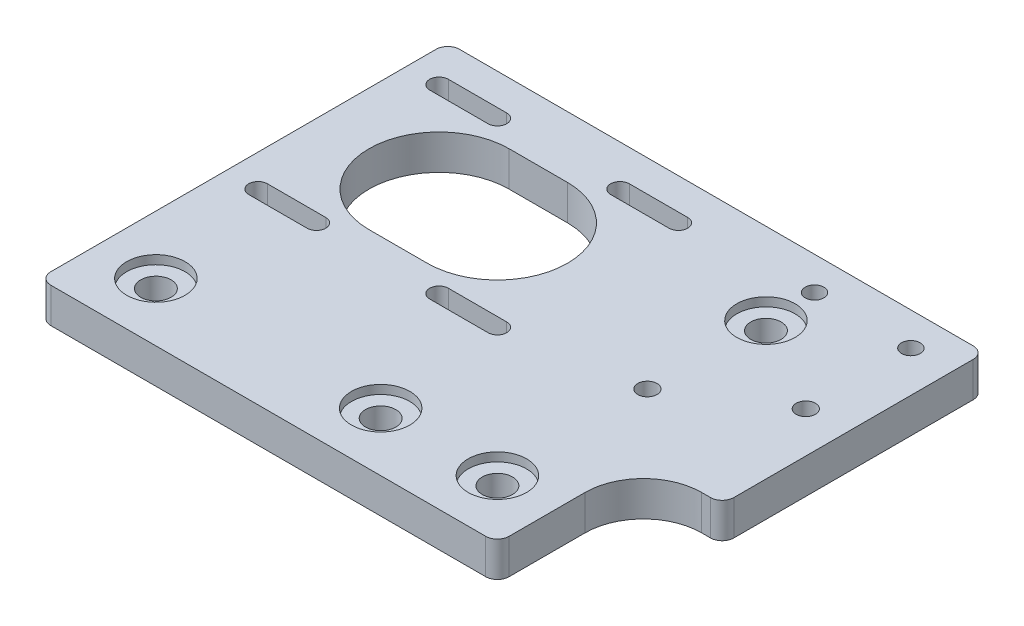
from build123d import *

# Parameters (mm, degrees)
SKETCH3_R             = 2.6
BOSS_EXTRUDE1_DEPTH   = 6
FILLET1_R             = 10
M3_CLEARANCE_HOLE1_D  = 3.2
M4X0_7_TAPPED_HOLE1_D = 3.3
FILLET2_R             = 2
SKETCH5_R             = 5
COUNTERBORE_DEPTH     = 1.5


with BuildPart() as part:
    # Sketch3 → Boss-Extrude1 (new body)
    with BuildSketch(Plane(origin=(0, 0, 0), x_dir=(1, 0, 0), z_dir=(0, 1, 0))):
        Polygon((0, 0), (78.5, 0), (78.5, 70), (0, 70), (-13.5, 70), (-13.5, 25), (0, 25), align=None)
        with Locations((10, 56)):
            Circle(SKETCH3_R, mode=Mode.SUBTRACT)
        with Locations((10, 10)):
            Circle(SKETCH3_R, mode=Mode.SUBTRACT)
        with Locations((68.5, 10)):
            Circle(SKETCH3_R, mode=Mode.SUBTRACT)
        with Locations((30, 10)):
            Circle(SKETCH3_R, mode=Mode.SUBTRACT)
        with BuildLine():
            Line((47.5, 59.5), (57.5, 59.5))
            ThreePointArc((57.5, 59.5), (69.5, 47.5), (57.5, 35.5))
            Line((57.5, 35.5), (47.5, 35.5))
            ThreePointArc((47.5, 35.5), (35.5, 47.5), (47.5, 59.5))
        make_face(mode=Mode.SUBTRACT)
        with BuildLine():
            Line((32, 64.6), (42, 64.6))
            ThreePointArc((42, 64.6), (43.6, 63), (42, 61.4))
            Line((42, 61.4), (32, 61.4))
            ThreePointArc((32, 61.4), (30.4, 63), (32, 64.6))
        make_face(mode=Mode.SUBTRACT)
        with BuildLine():
            Line((63, 64.6), (73, 64.6))
            ThreePointArc((73, 64.6), (74.6, 63), (73, 61.4))
            Line((73, 61.4), (63, 61.4))
            ThreePointArc((63, 61.4), (61.4, 63), (63, 64.6))
        make_face(mode=Mode.SUBTRACT)
        with BuildLine():
            Line((63, 33.6), (73, 33.6))
            ThreePointArc((73, 33.6), (74.6, 32), (73, 30.4))
            Line((73, 30.4), (63, 30.4))
            ThreePointArc((63, 30.4), (61.4, 32), (63, 33.6))
        make_face(mode=Mode.SUBTRACT)
        with BuildLine():
            Line((32, 33.6), (42, 33.6))
            ThreePointArc((42, 33.6), (43.6, 32), (42, 30.4))
            Line((42, 30.4), (32, 30.4))
            ThreePointArc((32, 30.4), (30.4, 32), (32, 33.6))
        make_face(mode=Mode.SUBTRACT)
    extrude(amount=BOSS_EXTRUDE1_DEPTH)

    # Fillet1
    fillet1_edges = [part.edges().sort_by_distance(p)[0] for p in [
        (0, 3, -25),
    ]]
    fillet(fillet1_edges, radius=FILLET1_R)

    # M3 Clearance Hole1 (through all)
    with Locations(Plane(origin=(0, 6, 0), x_dir=(1, 0, 0), z_dir=(0, 1, 0))):
        with Locations((10, 64.325), (-6.5, 64.325)):
            Hole(M3_CLEARANCE_HOLE1_D / 2)

    # M4x0.7 Tapped Hole1 (through all)
    with Locations(Plane(origin=(0, 6, 0), x_dir=(1, 0, 0), z_dir=(0, 1, 0))):
        with Locations((-6.5, 46.325), (10, 35.7)):
            Hole(M4X0_7_TAPPED_HOLE1_D / 2)

    # Fillet2
    fillet2_edges = [part.edges().sort_by_distance(p)[0] for p in [
        (-13.5, 3, -25),
        (0, 3, 0),
        (-13.5, 3, -70),
        (78.5, 3, 0),
        (78.5, 3, -70),
    ]]
    fillet(fillet2_edges, radius=FILLET2_R)

    # Sketch5 → Counterbore (cut)
    with BuildSketch(Plane(origin=(0, 6, 0), x_dir=(1, 0, 0), z_dir=(0, 1, 0))):
        with Locations((10, 56)):
            Circle(SKETCH5_R)
        with Locations((10, 10)):
            Circle(SKETCH5_R)
        with Locations((30, 10)):
            Circle(SKETCH5_R)
        with Locations((68.5, 10)):
            Circle(SKETCH5_R)
    extrude(amount=-COUNTERBORE_DEPTH, mode=Mode.SUBTRACT)


with BuildPart() as body_2:
    # Mirror1: mirrored copy
    add(part.part.mirror(Plane(origin=(78.5, 6, 0), x_dir=(0, 0, 1), z_dir=(-1, 0, 0))))


solid = body_2.part
